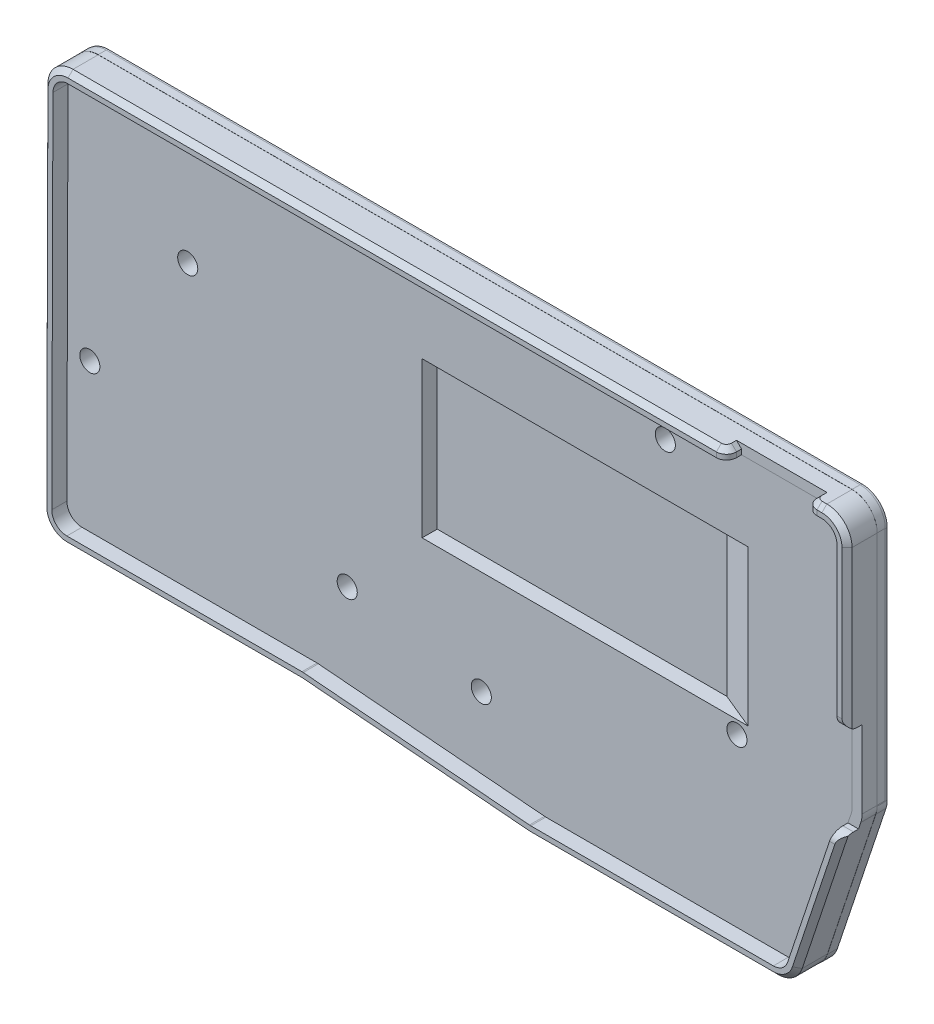
from build123d import *
from OCP.BRepFilletAPI import BRepFilletAPI_MakeChamfer

# Parameters (mm, degrees)
BOSS_EXTRUDE1_DEPTH        = 1.6
BOSS_EXTRUDE2_DEPTH        = 4.4
SKETCH5_R                  = 0.994649107
SKETCH5_R_2                = 1
CUT_EXTRUDE3_DEPTH         = 310.975793847
SKETCH7_W                  = 3.425113008
SKETCH7_H                  = 21.223825588
CUT_EXTRUDE6_DEPTH         = 4.4
SKETCH6_W                  = 15.814968861
SKETCH6_H                  = 3.288477367
CUT_EXTRUDE7_DEPTH         = 4.4
FILLET6_R                  = 0.5
BOSS_EXTRUDE4_START        = -2
BOSS_EXTRUDE4_DEPTH        = 2
BOSS_EXTRUDE5_START        = 1.6
BOSS_EXTRUDE5_DEPTH        = 6
BOSS_EXTRUDE15_OUTLINE_R   = 1
BOSS_EXTRUDE15_OUTLINE_R_2 = 0.994649107
BOSS_EXTRUDE15_DEPTH       = 3
SKETCH21_W                 = 48.848282907
SKETCH21_H                 = 30.860232783
CUT_EXTRUDE8_DEPTH         = 3
CHAMFER1_SIZE              = 10
CHAMFER2_SIZE              = 6
BOSS_EXTRUDE17_DEPTH       = 2
SKETCH22_R                 = 5.5
CUT_EXTRUDE9_DEPTH         = 2
SKETCH23_R                 = 2
CUT_EXTRUDE10_DEPTH        = 3
SKETCH24_W                 = 16.007714331
SKETCH24_H                 = 7.261231243
CUT_EXTRUDE12_DEPTH        = 3
FILLET7_R                  = 2
CHAMFER3_SIZE              = 1
CHAMFER3_SIZE2             = 1.000641849
CHAMFER3_SIZE2_2           = 1.000453728
CHAMFER3_SIZE2_3           = 0.999359385
CHAMFER3_SIZE2_4           = 0.999546889
SKETCH26_W                 = 9.300839027
SKETCH26_H                 = 18.332088517
CUT_EXTRUDE13_DEPTH        = 3
FILLET9_R                  = 2


# Read off the part's stored shape, not the designer's step: Boss-Extrude5, Boss-Extrude15
with BuildPart() as part:
    # Model → Boss-Extrude1 (new body)
    with BuildSketch(Plane.XY):
        with BuildLine():
            Line((251.946793894, -87.401925306), (101.987200094, -87.498084106))
            ThreePointArc((101.987200094, -87.498084106), (98.45940755, -88.958019741), (96.9904319, -92.4820576))
            Line((96.9904319, -92.4820576), (96.7596565, -164.4839745))
            ThreePointArc((96.7596565, -164.4839745), (98.218435569, -168.029863482), (101.7596308, -169.5))
            Line((101.7596308, -169.5), (148.5292403, -169.5))
            ThreePointArc((148.5292403, -169.5), (148.571123302, -169.500877492), (148.6129328, -169.5035084))
            Line((148.6129328, -169.5035084), (193.6072971, -173.2824582))
            ThreePointArc((193.6072971, -173.2824582), (193.816344642, -173.295612642), (194.025759697, -173.3))
            Line((194.025759697, -173.3), (242.287722297, -173.3))
            ThreePointArc((242.287722297, -173.3), (245.211273709, -172.356210957), (247.031138795, -169.881138901))
            Line((247.031138795, -169.881138901), (256.693416495, -140.894305901))
            ThreePointArc((256.693416495, -140.894305901), (256.885437294, -140.114078252), (256.949999995, -139.313167002))
            Line((256.949999995, -139.313167002), (256.949999987, -92.401924286))
            ThreePointArc((256.949999987, -92.401924286), (255.484400195, -88.865257026), (251.946793894, -87.401925306))
        make_face()
    extrude(amount=BOSS_EXTRUDE1_DEPTH)

    # Sketch2 → Boss-Extrude2 (add)
    with BuildSketch(Plane.XY.offset(1.6)):
        with BuildLine():
            Line((251.944046754, -87.429159909), (101.984452954, -87.525318709))
            ThreePointArc((101.984452954, -87.525318709), (98.456660391, -88.985254335), (96.987684718, -92.5092922))
            Line((96.987684718, -92.5092922), (96.756909337, -164.511209099))
            ThreePointArc((96.756909337, -164.511209099), (98.215688409, -168.057098081), (101.756883646, -169.52723459))
            Line((101.756883646, -169.52723459), (148.526493146, -169.52723459))
            ThreePointArc((148.526493146, -169.52723459), (148.568376149, -169.528112068), (148.610185649, -169.530742962))
            Line((148.610185649, -169.530742962), (193.604549946, -173.30969279))
            ThreePointArc((193.604549946, -173.30969279), (193.813597487, -173.322847264), (194.023012543, -173.327234656))
            Line((194.023012543, -173.327234656), (242.284975143, -173.327234656))
            ThreePointArc((242.284975143, -173.327234656), (245.208526528, -172.383445619), (247.028391624, -169.908373604))
            Line((247.028391624, -169.908373604), (256.690669383, -140.921540527))
            ThreePointArc((256.690669383, -140.921540527), (256.882690198, -140.141312872), (256.947252916, -139.340401614))
            Line((256.947252916, -139.340401614), (256.947252866, -92.429158894))
            ThreePointArc((256.947252866, -92.429158894), (255.48165306, -88.892491634), (251.944046754, -87.429159909))
        make_face()
        with BuildLine():
            Line((251.945329254, -89.429159503), (101.985735454, -89.525318303))
            ThreePointArc((101.985735454, -89.525318303), (99.869059876, -90.401279658), (98.98767445, -92.515702399))
            Line((98.98767445, -92.515702399), (98.75689905, -164.517619299))
            ThreePointArc((98.75689905, -164.517619299), (99.632166497, -166.645152695), (101.756883646, -167.527234603))
            Line((101.756883646, -167.527234603), (148.526493146, -167.527234603))
            ThreePointArc((148.526493146, -167.527234603), (148.652142149, -167.529867037), (148.777570644, -167.537759718))
            Line((148.777570644, -167.537759718), (193.771935044, -171.316709518))
            ThreePointArc((193.771935044, -171.316709518), (193.897363539, -171.324602199), (194.023012543, -171.327234633))
            Line((194.023012543, -171.327234633), (242.284975143, -171.327234633))
            ThreePointArc((242.284975143, -171.327234633), (244.039105969, -170.760961212), (245.131025025, -169.275918008))
            Line((245.131025025, -169.275918008), (254.793302725, -140.289085008))
            ThreePointArc((254.793302725, -140.289085008), (254.908515227, -139.820948393), (254.947252862, -139.340401614))
            Line((254.947252862, -139.340401614), (254.947252862, -92.429158914))
            ThreePointArc((254.947252862, -92.429158914), (254.067893006, -90.307158566), (251.945329254, -89.429159503))
        make_face(mode=Mode.SUBTRACT)
    extrude(amount=BOSS_EXTRUDE2_DEPTH)

    # Sketch5 → Cut-Extrude3 (cut, through all)
    with BuildSketch(Plane.XY.offset(1.6)):
        with Locations((122.797146862, -111.498691659)):
            Circle(SKETCH5_R)
        with Locations((103.322146862, -138.098691659)):
            Circle(SKETCH5_R_2)
        with Locations((154.527146862, -151.398691659)):
            Circle(SKETCH5_R_2)
        with Locations((181.197146862, -156.148691659)):
            Circle(SKETCH5_R_2)
        with Locations((232.047146862, -138.098691659)):
            Circle(SKETCH5_R_2)
        with Locations((217.797146862, -94.398691659)):
            Circle(SKETCH5_R_2)
    extrude(amount=-CUT_EXTRUDE3_DEPTH, mode=Mode.SUBTRACT)

    # Sketch7 → Cut-Extrude6 (cut)
    with BuildSketch(Plane(origin=(256.947252768, 2.72e-07, 0), x_dir=(0, 0, -1), z_dir=(1.0, 1.0603745333403191e-09, 0))):
        with Locations((-3.312556504, -132.629055883)):
            Rectangle(SKETCH7_W, SKETCH7_H)
    extrude(amount=-CUT_EXTRUDE6_DEPTH, mode=Mode.SUBTRACT)

    # Sketch6 → Cut-Extrude7 (cut)
    with BuildSketch(Plane(origin=(0.056165893, -87.590678327, 0), x_dir=(0.9999997944112105, 0.0006412312663307875, 0), z_dir=(-0.0006412312663307874, 0.9999997944112103, 0))):
        with Locations((234.245539672, -3.485378164)):
            Rectangle(SKETCH6_W, SKETCH6_H)
    extrude(amount=-CUT_EXTRUDE7_DEPTH, mode=Mode.SUBTRACT)

    # Fillet6
    # the kernel refuses this fillet: 0.5 mm, written as the material it takes off along each edge
    with BuildSketch(Plane(origin=(226.395457064, -89.445542883, 5.129616847), x_dir=(0, 0, 1), z_dir=(0.9999997944112105, 0.0006412312663308005, 0))) as fillet6_piece_1:
        with BuildLine():
            CenterArc((FILLET6_R, -FILLET6_R), FILLET6_R, 90, 90)
            Line((0, -FILLET6_R), (-FILLET6_R * 0.02, -FILLET6_R))
            Line((-FILLET6_R * 0.02, -FILLET6_R), (-FILLET6_R * 0.02, FILLET6_R * 0.02))
            Line((-FILLET6_R * 0.02, FILLET6_R * 0.02), (FILLET6_R, FILLET6_R * 0.02))
            Line((FILLET6_R, FILLET6_R * 0.02), (FILLET6_R, 0))
        make_face()
    extrude(amount=15.814968862, mode=Mode.SUBTRACT)
    with BuildSketch(Plane(origin=(226.394174601, -87.44554329, 5.129616847), x_dir=(-0.9999997944112105, -0.000641231266286041, 0), z_dir=(0, 0, -1)), Plane(origin=(242.209140212, -87.435402237, 1.84113948), x_dir=(0.9999997944112105, 0.000641231266399655, 0), z_dir=(0, 0, 1))) as fillet6_piece_2:
        with BuildLine():
            CenterArc((FILLET6_R, -FILLET6_R), FILLET6_R, 90, 90)
            Line((0, -FILLET6_R), (-FILLET6_R * 0.0200000000001, -FILLET6_R))
            Line((-FILLET6_R * 0.0200000000001, -FILLET6_R), (-FILLET6_R * 0.02, FILLET6_R * 0.02))
            Line((-FILLET6_R * 0.02, FILLET6_R * 0.02), (FILLET6_R, FILLET6_R * 0.02))
            Line((FILLET6_R, FILLET6_R * 0.02), (FILLET6_R, 0))
        make_face()
    extrude(amount=3.288477367, mode=Mode.SUBTRACT)
    with BuildSketch(Plane(origin=(226.394174601, -87.44554329, 1.84113948), x_dir=(0, 0, -1), z_dir=(0.9999997944112105, 0.0006412312663307875, 0))) as fillet6_piece_3:
        with BuildLine():
            CenterArc((0.5, -0.427774743), FILLET6_R, 121.179507185, 58.820492815)
            Line((0, -0.427774743), (-0.01, -0.427774743))
            Line((-0.01, -0.427774743), (-0.01, 0))
            Line((-0.01, 0), (0, 0.01))
            ThreePointArc((0, 0.01), (0.12056974, 0.01), (0.235962269, 0.008555495))
            Line((0.235962269, 0.008555495), (0.24113948, 0))
        make_face()
    extrude(amount=15.814968862, mode=Mode.SUBTRACT)
    with BuildSketch(Plane(origin=(225.324737963, -87.446229046, 1.84113948), x_dir=(0, 0, -1), z_dir=(0.9999997944112105, 0.0006412312663307875, 0))) as fillet6_piece_4a_section:
        with BuildLine():
            CenterArc((0.5, -0.427774743), FILLET6_R, 121.179507185, 58.820492815)
            Line((0, -0.427774743), (-0.01, -0.427774743))
            Line((-0.01, -0.427774743), (-0.01, 0))
            Line((-0.01, 0), (0, 0.01))
            ThreePointArc((0, 0.01), (0.12056974, 0.01), (0.235962269, 0.008555495))
            Line((0.235962269, 0.008555495), (0.24113948, 0))
        make_face()
    fillet6_piece_4a = extrude(amount=16.88440572, mode=Mode.PRIVATE)
    fillet6_piece_4a = split(fillet6_piece_4a, bisect_by=Plane(origin=(226.394243451, -87.552914284, 1.778737218), z_dir=(-0.9999997944112105, -0.0006412312663307876, 0)), keep=Keep.TOP, mode=Mode.PRIVATE)
    with BuildSketch(Plane(origin=(226.394174601, -87.44554329, 5.129616847), x_dir=(-0.9999997944112105, -0.000641231266286041, 0), z_dir=(0, 0, -1))) as fillet6_piece_4b_section:
        with BuildLine():
            CenterArc((FILLET6_R, -FILLET6_R), FILLET6_R, 90, 90)
            Line((0, -FILLET6_R), (-FILLET6_R * 0.0200000000001, -FILLET6_R))
            Line((-FILLET6_R * 0.0200000000001, -FILLET6_R), (-FILLET6_R * 0.02, FILLET6_R * 0.02))
            Line((-FILLET6_R * 0.02, FILLET6_R * 0.02), (FILLET6_R, FILLET6_R * 0.02))
            Line((FILLET6_R, FILLET6_R * 0.02), (FILLET6_R, 0))
        make_face()
    fillet6_piece_4b = extrude(amount=4.538477367, mode=Mode.PRIVATE)
    fillet6_piece_4b = split(fillet6_piece_4b, bisect_by=Plane(origin=(226.281049653, -87.558813409, 1.6), z_dir=(0, 0, 1)), keep=Keep.TOP, mode=Mode.PRIVATE)
    fillet6_piece_4b = split(fillet6_piece_4b, bisect_by=Plane(origin=(226.281049653, -87.558813409, 1.84113948), z_dir=(0, 0, -1)), keep=Keep.TOP, mode=Mode.PRIVATE)
    fillet6_piece_4 = fillet6_piece_4a & fillet6_piece_4b
    add(fillet6_piece_4, mode=Mode.SUBTRACT)
    with BuildSketch(Plane(origin=(226.394174601, -87.44554329, 1.84113948), x_dir=(0, 0, -1), z_dir=(0.9999997944112105, 0.0006412312663307875, 0))) as fillet6_piece_5a_section:
        with BuildLine():
            CenterArc((0.5, -0.427774743), FILLET6_R, 121.179507185, 58.820492815)
            Line((0, -0.427774743), (-0.01, -0.427774743))
            Line((-0.01, -0.427774743), (-0.01, 0))
            Line((-0.01, 0), (0, 0.01))
            ThreePointArc((0, 0.01), (0.12056974, 0.01), (0.235962269, 0.008555495))
            Line((0.235962269, 0.008555495), (0.24113948, 0))
        make_face()
    fillet6_piece_5a = extrude(amount=16.88440572, mode=Mode.PRIVATE)
    fillet6_piece_5a = split(fillet6_piece_5a, bisect_by=Plane(origin=(242.209209061, -87.542773231, 1.778737218), z_dir=(0.9999997944112105, 0.0006412312663307876, 0)), keep=Keep.TOP, mode=Mode.PRIVATE)
    with BuildSketch(Plane(origin=(242.209140212, -87.435402237, 0.59113948), x_dir=(0.9999997944112105, 0.0006412312663428115, 0), z_dir=(0, 0, 1))) as fillet6_piece_5b_section:
        with BuildLine():
            CenterArc((FILLET6_R, -FILLET6_R), FILLET6_R, 90, 90)
            Line((0, -FILLET6_R), (-FILLET6_R * 0.0199999999999, -FILLET6_R))
            Line((-FILLET6_R * 0.0199999999999, -FILLET6_R), (-FILLET6_R * 0.02, FILLET6_R * 0.02))
            Line((-FILLET6_R * 0.02, FILLET6_R * 0.02), (FILLET6_R, FILLET6_R * 0.02))
            Line((FILLET6_R, FILLET6_R * 0.02), (FILLET6_R, 0))
        make_face()
    fillet6_piece_5b = extrude(amount=4.538477367, mode=Mode.PRIVATE)
    fillet6_piece_5b = split(fillet6_piece_5b, bisect_by=Plane(origin=(242.322410331, -87.548527185, 1.6), z_dir=(0, 0, 1)), keep=Keep.TOP, mode=Mode.PRIVATE)
    fillet6_piece_5b = split(fillet6_piece_5b, bisect_by=Plane(origin=(242.322410331, -87.548527185, 1.84113948), z_dir=(0, 0, -1)), keep=Keep.TOP, mode=Mode.PRIVATE)
    fillet6_piece_5 = fillet6_piece_5a & fillet6_piece_5b
    add(fillet6_piece_5, mode=Mode.SUBTRACT)

    # Sketch3 → Boss-Extrude4 (add)
    with BuildSketch(Plane.XY.offset(1.6).offset(BOSS_EXTRUDE4_START)):
        with BuildLine():
            Line((256.947146899, -139.411858721), (256.947146899, -92.500616021))
            ThreePointArc((256.947146899, -92.500616021), (255.48154711, -88.963948716), (251.943940776, -87.500616973))
            Line((251.943940776, -87.500616973), (101.984346976, -87.596775773))
            ThreePointArc((101.984346976, -87.596775773), (98.456554415, -89.056711398), (96.987578743, -92.580749261))
            Line((96.987578743, -92.580749261), (96.756803362, -164.582666159))
            ThreePointArc((96.756803362, -164.582666159), (98.215582434, -168.128555142), (101.756777671, -169.59869165))
            Line((101.756777671, -169.59869165), (148.526387171, -169.59869165))
            ThreePointArc((148.526387171, -169.59869165), (148.568270174, -169.599569128), (148.610079674, -169.602200022))
            Line((148.610079674, -169.602200022), (193.604443971, -173.38114985))
            ThreePointArc((193.604443971, -173.38114985), (193.813491512, -173.394304325), (194.022906568, -173.398691716))
            Line((194.022906568, -173.398691716), (242.284869168, -173.398691716))
            ThreePointArc((242.284869168, -173.398691716), (245.208420529, -172.454902688), (247.028285609, -169.979830694))
            Line((247.028285609, -169.979830694), (256.690563368, -140.992997616))
            ThreePointArc((256.690563368, -140.992997616), (256.882584182, -140.21276997), (256.947146899, -139.411858721))
        make_face()
        with BuildLine():
            Line((254.947252862, -139.340401614), (254.947252862, -92.429158914))
            ThreePointArc((254.947252862, -92.429158914), (254.067893006, -90.307158566), (251.945329254, -89.429159503))
            Line((251.945329254, -89.429159503), (101.985735454, -89.525318303))
            ThreePointArc((101.985735454, -89.525318303), (99.869059876, -90.401279658), (98.98767445, -92.515702399))
            Line((98.98767445, -92.515702399), (98.75689905, -164.517619299))
            ThreePointArc((98.75689905, -164.517619299), (99.632166497, -166.645152695), (101.756883646, -167.527234603))
            Line((101.756883646, -167.527234603), (148.526493146, -167.527234603))
            ThreePointArc((148.526493146, -167.527234603), (148.652142149, -167.529867037), (148.777570644, -167.537759718))
            Line((148.777570644, -167.537759718), (193.771935044, -171.316709518))
            ThreePointArc((193.771935044, -171.316709518), (193.897363539, -171.324602199), (194.023012543, -171.327234633))
            Line((194.023012543, -171.327234633), (242.284975143, -171.327234633))
            ThreePointArc((242.284975143, -171.327234633), (244.039105969, -170.760961212), (245.131025025, -169.275918008))
            Line((245.131025025, -169.275918008), (254.793302725, -140.289085008))
            ThreePointArc((254.793302725, -140.289085008), (254.908515227, -139.820948393), (254.947252862, -139.340401614))
        make_face(mode=Mode.SUBTRACT)
    extrude(amount=BOSS_EXTRUDE4_DEPTH)

    # Boss-Extrude5 outline → Boss-Extrude5 (add)
    with BuildSketch(Plane.XY.offset(BOSS_EXTRUDE5_START)):
        with BuildLine():
            ThreePointArc((256.947252866, -92.429158894), (255.481653059, -88.892491633), (251.944046754, -87.429159909))
            Line((251.944046754, -87.429159909), (101.984452954, -87.525318709))
            ThreePointArc((101.984452954, -87.525318709), (98.456660391, -88.985254335), (96.987684718, -92.5092922))
            Line((96.987684718, -92.5092922), (96.756909337, -164.511209099))
            ThreePointArc((96.756909337, -164.511209099), (98.215688409, -168.057098081), (101.756883646, -169.52723459))
            Line((101.756883646, -169.52723459), (148.526493146, -169.52723459))
            ThreePointArc((148.526493146, -169.52723459), (148.568376149, -169.528112068), (148.610185649, -169.530742962))
            Line((148.610185649, -169.530742962), (193.604549946, -173.30969279))
            ThreePointArc((193.604549946, -173.30969279), (193.813597487, -173.322847264), (194.023012543, -173.327234656))
            Line((194.023012543, -173.327234656), (242.284975143, -173.327234656))
            ThreePointArc((242.284975143, -173.327234656), (245.208526528, -172.383445619), (247.028391624, -169.908373604))
            Line((247.028391624, -169.908373604), (256.690669383, -140.921540527))
            ThreePointArc((256.690669383, -140.921540527), (256.882690198, -140.141312872), (256.947252916, -139.340401614))
            Line((256.947252916, -139.340401614), (256.947252866, -92.429158894))
        make_face()
        with BuildLine():
            Line((254.947252862, -92.429158914), (254.947252862, -139.340401614))
            ThreePointArc((254.947252862, -139.340401614), (254.908515227, -139.820948393), (254.793302725, -140.289085008))
            Line((254.793302725, -140.289085008), (245.131025025, -169.275918008))
            ThreePointArc((245.131025025, -169.275918008), (244.039105969, -170.760961212), (242.284975143, -171.327234633))
            Line((242.284975143, -171.327234633), (194.023012543, -171.327234633))
            ThreePointArc((194.023012543, -171.327234633), (193.897363539, -171.324602199), (193.771935044, -171.316709518))
            Line((193.771935044, -171.316709518), (148.777570644, -167.537759718))
            ThreePointArc((148.777570644, -167.537759718), (148.652142149, -167.529867037), (148.526493146, -167.527234603))
            Line((148.526493146, -167.527234603), (101.756883646, -167.527234603))
            ThreePointArc((101.756883646, -167.527234603), (99.632166497, -166.645152695), (98.75689905, -164.517619299))
            Line((98.75689905, -164.517619299), (98.98767445, -92.515702399))
            ThreePointArc((98.98767445, -92.515702399), (99.869059876, -90.401279658), (101.985735454, -89.525318303))
            Line((101.985735454, -89.525318303), (251.945329254, -89.429159503))
            ThreePointArc((251.945329254, -89.429159503), (254.067893006, -90.307158566), (254.947252862, -92.429158914))
        make_face(mode=Mode.SUBTRACT)
    extrude(amount=BOSS_EXTRUDE5_DEPTH)


with BuildPart() as body_2:
    # Boss-Extrude15 outline → Boss-Extrude15 (new body)
    with BuildSketch(Plane.XY.offset(1.6)):
        with BuildLine():
            ThreePointArc((98.75689767, -164.517619295), (99.632363444, -166.644955974), (101.756883646, -167.527234603))
            Line((101.756883646, -167.527234603), (148.526493146, -167.527234603))
            ThreePointArc((148.526493146, -167.527234603), (148.652142149, -167.529867037), (148.777570644, -167.537759718))
            Line((148.777570644, -167.537759718), (194.023012543, -171.327234633))
            Line((194.023012543, -171.327234633), (242.284975143, -171.327234633))
            ThreePointArc((242.284975143, -171.327234633), (244.039105969, -170.760961212), (245.131025025, -169.275918008))
            Line((245.131025025, -169.275918008), (254.793302725, -140.289085008))
            Line((254.793302725, -140.289085008), (254.908515227, -139.820948393))
            Line((254.908515227, -139.820948393), (254.947252862, -139.340401614))
            Line((254.947252862, -139.340401614), (254.947252862, -92.429158894))
            ThreePointArc((254.947252862, -92.429158894), (254.067892999, -90.307158559), (251.945329254, -89.429159503))
            Line((251.945329254, -89.429159503), (101.985735454, -89.525318303))
            ThreePointArc((101.985735454, -89.525318303), (99.869059876, -90.401279658), (98.98767445, -92.515702399))
            Line((98.98767445, -92.515702399), (98.75689767, -164.517619295))
        make_face()
        with Locations((154.527146862, -151.398691659)):
            Circle(BOSS_EXTRUDE15_OUTLINE_R, mode=Mode.SUBTRACT)
        with Locations((103.322146862, -138.098691659)):
            Circle(BOSS_EXTRUDE15_OUTLINE_R, mode=Mode.SUBTRACT)
        with Locations((181.197146862, -156.148691659)):
            Circle(BOSS_EXTRUDE15_OUTLINE_R, mode=Mode.SUBTRACT)
        with Locations((232.047146862, -138.098691659)):
            Circle(BOSS_EXTRUDE15_OUTLINE_R, mode=Mode.SUBTRACT)
        with Locations((122.797146862, -111.498691659)):
            Circle(BOSS_EXTRUDE15_OUTLINE_R_2, mode=Mode.SUBTRACT)
        with Locations((217.797146862, -94.398691659)):
            Circle(BOSS_EXTRUDE15_OUTLINE_R, mode=Mode.SUBTRACT)
    extrude(amount=BOSS_EXTRUDE15_DEPTH)

    # Sketch21 → Cut-Extrude8 (cut)
    with BuildSketch(Plane.XY.offset(4.6)):
        with Locations((193.851271066, -120.086059073)):
            Rectangle(SKETCH21_W, SKETCH21_H)
    extrude(amount=-CUT_EXTRUDE8_DEPTH, mode=Mode.SUBTRACT)

    # Chamfer1
    # the kernel refuses this chamfer: 10 mm, written as the material it takes off along each edge
    with BuildSketch(Plane(origin=(218.275412519, -135.516175464, 4.6), x_dir=(0.9996219169112968, 0, 0.027495876610586365), z_dir=(0, 1, 0))) as chamfer1_piece_1:
        Polygon((CHAMFER1_SIZE * 0.999621916911, CHAMFER1_SIZE * 0.0274958766106), (-CHAMFER1_SIZE * 0.0274958766106, CHAMFER1_SIZE * 0.999621916911), (0, 0), align=None)
    extrude(amount=30.860232783, mode=Mode.SUBTRACT)

    # Chamfer2
    # the kernel refuses this chamfer: 6 mm, written as the material it takes off along each edge
    with BuildSketch(Plane(origin=(228.275412519, -135.516175464, 4.6), x_dir=(0.9998910622590335, 0, 0.014760203741874704), z_dir=(0, 1, 0))) as chamfer2_piece_1:
        Polygon((CHAMFER2_SIZE * 0.999891062259, CHAMFER2_SIZE * 0.0147602037425), (-CHAMFER2_SIZE * 0.717466790728, CHAMFER2_SIZE * 0.696592710414), (0, 0), align=None)
    extrude(amount=30.860232783, mode=Mode.SUBTRACT)

    # Sketch23 → Cut-Extrude10 (cut)
    with BuildSketch(Plane.XY.offset(4.6)):
        with Locations((122.797146862, -111.498691659)):
            Circle(SKETCH23_R)
        with Locations((103.322146862, -138.098691659)):
            Circle(SKETCH23_R)
        with Locations((154.527146862, -151.398691659)):
            Circle(SKETCH23_R)
        with Locations((181.197146862, -156.148691659)):
            Circle(SKETCH23_R)
        with Locations((232.047146862, -138.098691659)):
            Circle(SKETCH23_R)
        with Locations((217.797146862, -94.398691659)):
            Circle(SKETCH23_R)
    extrude(amount=-CUT_EXTRUDE10_DEPTH, mode=Mode.SUBTRACT)


with BuildPart() as body_3:
    # Sketch18<4> → Boss-Extrude17 (new body)
    with BuildSketch(Plane.XY.offset(1.6)):
        with BuildLine():
            Line((101.985735454, -89.525318303), (251.94532914, -89.429159503))
            ThreePointArc((251.94532914, -89.429159503), (254.06789296, -90.307158531), (254.947252862, -92.429158914))
            Line((254.947252862, -92.429158914), (254.947252862, -139.340401614))
            Line((254.947252862, -139.340401614), (254.908515227, -139.820948393))
            Line((254.908515227, -139.820948393), (254.793302725, -140.289085008))
            Line((254.793302725, -140.289085008), (245.131025025, -169.275918008))
            ThreePointArc((245.131025025, -169.275918008), (244.039105969, -170.760961212), (242.284975143, -171.327234633))
            Line((242.284975143, -171.327234633), (194.023012543, -171.327234633))
            Line((194.023012543, -171.327234633), (148.777570644, -167.537759718))
            Line((148.777570644, -167.537759718), (101.756883646, -167.527234603))
            ThreePointArc((101.756883646, -167.527234603), (99.632363411, -166.64495594), (98.756897671, -164.517619201))
            Line((98.756897671, -164.517619201), (98.98767445, -92.515702399))
            ThreePointArc((98.98767445, -92.515702399), (99.869059904, -90.401279685), (101.985735454, -89.525318303))
        make_face()
    extrude(amount=-BOSS_EXTRUDE17_DEPTH)


with BuildPart() as cut_extrude9_tool:
    # Sketch22 → Cut-Extrude9 (new body)
    with BuildSketch(Plane(origin=(0, 0, -0.4), x_dir=(-1, 0, 0), z_dir=(0, 0, -1))):
        with Locations((-246.990281525, -96.89962749)):
            Circle(SKETCH22_R)
        with Locations((-105.396272288, -96.89962749)):
            Circle(SKETCH22_R)
        with Locations((-237.748714489, -163.405904556)):
            Circle(SKETCH22_R)
        with Locations((-105.396272288, -160.270372883)):
            Circle(SKETCH22_R)
    extrude(amount=-CUT_EXTRUDE9_DEPTH)


with BuildPart() as part_1:
    add(part.part)

    # Cut-Extrude9: cut by cut_extrude9_tool
    add(cut_extrude9_tool.part, mode=Mode.SUBTRACT)

    # Sketch24 → Cut-Extrude12 (cut)
    with BuildSketch(Plane.XY.offset(7.6)):
        with Locations((240.966760154, -88.648228351)):
            Rectangle(SKETCH24_W, SKETCH24_H)
    extrude(amount=-CUT_EXTRUDE12_DEPTH, mode=Mode.SUBTRACT)

    # Fillet7
    fillet7_edges = [part_1.edges().sort_by_distance(p)[0] for p in [
        (248.970617319, -88.431066774, 7.6),
        (232.962902988, -88.441331423, 7.6),
    ]]
    fillet(fillet7_edges, radius=FILLET7_R)

    # Chamfer3: one chamfer whose edges measure the first distance from different faces: ONE call of the kernel's chamfer builder (chamfer() names one face for all edges)
    chamfer3_edges_1 = [part_1.edges().sort_by_distance(p)[0] for p in [
        (255.481653059, -88.892491633, 7.6),
        (256.947252891, -115.884780254, 7.6),
        (256.882690198, -140.141312872, 7.6),
        (251.859530503, -155.414957066, 7.6),
        (245.208526528, -172.383445619, 7.6),
        (218.153993843, -173.327234656, 7.6),
        (193.813597487, -173.322847264, 7.6),
        (171.107367797, -171.420217876, 7.6),
        (251.457332036, -87.429472006, 7.6),
        (148.568376149, -169.528112068, 7.6),
        (166.473677971, -87.483966193, 7.6),
        (98.456660391, -88.985254335, 7.6),
        (96.872297027, -128.510250649, 7.6),
        (98.215688409, -168.057098081, 7.6),
        (125.141688396, -169.52723459, 7.6),
    ]]
    chamfer3_edges_2 = [part_1.edges().sort_by_distance(p)[0] for p in [
        (248.970617319, -87.431066566, 5.1),
    ]]
    chamfer3_side_2 = [part_1.faces().sort_by_distance(p)[0] for p in [
        (173.219054302, -87.479640846, 4.510098102),
    ]]
    chamfer3_edges_3 = [part_1.edges().sort_by_distance(p)[0] for p in [
        (249.556403829, -87.430690941, 7.014213635),
    ]]
    chamfer3_side_3 = [part_1.faces().sort_by_distance(p)[0] for p in [
        (173.219054302, -87.479640846, 4.510098102),
    ]]
    chamfer3_edges_4 = [part_1.edges().sort_by_distance(p)[0] for p in [
        (232.962902988, -87.441331215, 5.1),
    ]]
    chamfer3_side_4 = [part_1.faces().sort_by_distance(p)[0] for p in [
        (173.219054302, -87.479640846, 4.510098102),
    ]]
    chamfer3_edges_5 = [part_1.edges().sort_by_distance(p)[0] for p in [
        (232.377116477, -87.441706839, 7.014213635),
    ]]
    chamfer3_side_5 = [part_1.faces().sort_by_distance(p)[0] for p in [
        (173.219054302, -87.479640846, 4.510098102),
    ]]
    chamfer3 = BRepFilletAPI_MakeChamfer(part_1.part.solid().wrapped)
    for e in chamfer3_edges_1:
        chamfer3.Add(CHAMFER3_SIZE, e.wrapped)
    for e in chamfer3_edges_2:
        chamfer3.Add(CHAMFER3_SIZE, CHAMFER3_SIZE2, e.wrapped, chamfer3_side_2[0].wrapped)  # the first distance lies on this face
    for e in chamfer3_edges_3:
        chamfer3.Add(CHAMFER3_SIZE, CHAMFER3_SIZE2_2, e.wrapped, chamfer3_side_3[0].wrapped)  # the first distance lies on this face
    for e in chamfer3_edges_4:
        chamfer3.Add(CHAMFER3_SIZE, CHAMFER3_SIZE2_3, e.wrapped, chamfer3_side_4[0].wrapped)  # the first distance lies on this face
    for e in chamfer3_edges_5:
        chamfer3.Add(CHAMFER3_SIZE, CHAMFER3_SIZE2_4, e.wrapped, chamfer3_side_5[0].wrapped)  # the first distance lies on this face
    add(Compound.cast(chamfer3.Shape()), mode=Mode.REPLACE)

    # Sketch26 → Cut-Extrude13 (cut)
    with BuildSketch(Plane.XY.offset(7.6)):
        with Locations((255.146049455, -133.105636478)):
            Rectangle(SKETCH26_W, SKETCH26_H)
    extrude(amount=-CUT_EXTRUDE13_DEPTH, mode=Mode.SUBTRACT)

    # Fillet9
    fillet9_edges = [part_1.edges().sort_by_distance(p)[0] for p in [
        (255.447252881, -123.939592219, 7.6),
        (254.659483785, -142.271680736, 7.6),
    ]]
    fillet(fillet9_edges, radius=FILLET9_R)


with BuildPart() as body_3_1:
    add(body_3.part)

    # Cut-Extrude9: cut by cut_extrude9_tool
    add(cut_extrude9_tool.part, mode=Mode.SUBTRACT)


solid = Compound([body_2.part, part_1.part, body_3_1.part])
